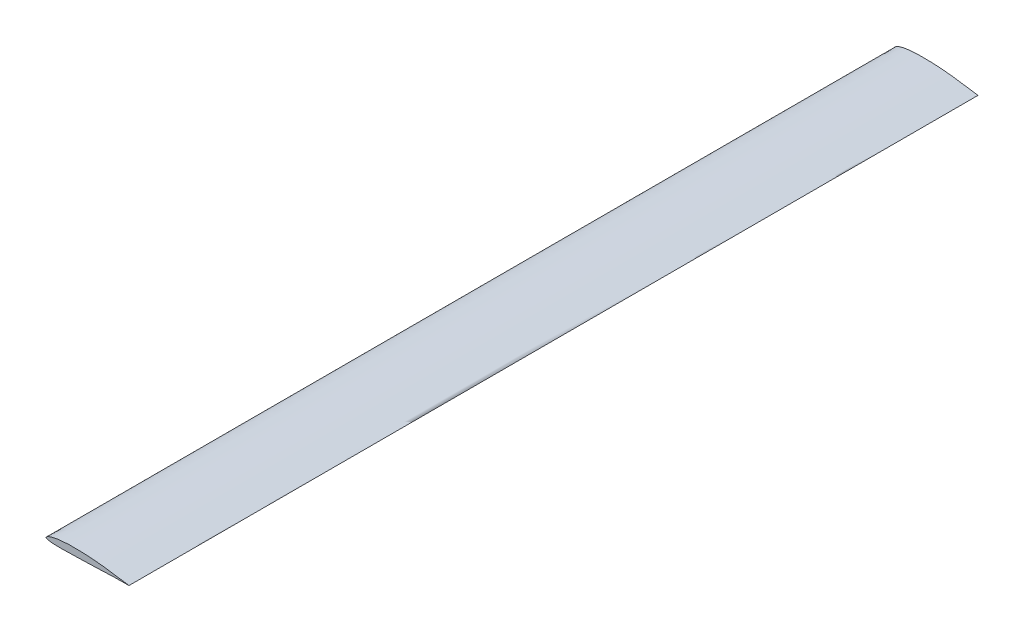
from build123d import *

# Parameters (mm, degrees)
BOSS_EXTRUDE1_DEPTH = 1800
SKETCH2_W           = 90
SKETCH2_H           = 10
BOSS_EXTRUDE2_DEPTH = 5


with BuildPart() as part:
    # Sketch1 → Boss-Extrude1 (new body)
    with BuildSketch(Plane.XY):
        with BuildLine():
            add(Edge.make_bspline(
                [(176, 0), (176.000448168, 0.008528228), (174.775687711, 0.116014347), (173.539862172, 0.292823553), (170.576644495, 0.68447631), (166.994008352, 1.231561447), (162.390893659, 1.953121821), (157.046507363, 2.81357381), (150.980940891, 3.784301173), (144.305054601, 4.825851118), (137.095965705, 5.894836578), (129.431536803, 6.938326969), (121.383114145, 7.919159936), (113.023648272, 8.817037249), (104.433502202, 9.617484246), (95.705002498, 10.319873845), (86.933937997, 10.910672491), (78.210236331, 11.352546191), (69.620135682, 11.632898447), (61.246487312, 11.752460911), (53.167199991, 11.68978229), (45.456481335, 11.437289203), (38.183363377, 11.016259402), (31.414274166, 10.41771219), (25.207733209, 9.646309609), (19.611741621, 8.718035158), (14.668117481, 7.652130641), (10.41084687, 6.468442078), (6.865637299, 5.199967353), (4.043833985, 3.882721172), (1.966727298, 2.57339806), (0.802827382, 1.536843817), (0.316772441, 0.842811405), (0.143667303, 0.535793127), (0.036783447, 0.259871381), (-0.005432106, 0.042345271), (0.003068779, -0.129064014), (0.087014725, -0.282932468), (0.24435104, -0.45921503), (0.496497658, -0.663687133), (1.106753569, -1.042725168), (2.465799929, -1.596705872), (4.850890225, -2.211164221), (8.227849509, -2.772826342), (12.457165416, -3.232096929), (17.509071166, -3.574246073), (23.341856395, -3.79928919), (29.904548764, -3.909503713), (37.134834963, -3.914209135), (44.960125584, -3.825485128), (53.297870775, -3.657038535), (62.05706854, -3.422344085), (71.140389764, -3.134787777), (80.445446567, -2.807726471), (89.866615493, -2.453169736), (99.295895108, -2.085526265), (108.623824195, -1.716511267), (117.740479476, -1.360901457), (126.536403649, -1.029166105), (134.904058565, -0.73233168), (142.739535017, -0.47819149), (149.939311258, -0.276242626), (156.414914239, -0.128343779), (162.052888361, -0.032203005), (166.844415568, 0.015172189), (170.523071372, 0.033657502), (173.526311225, 0.014823685), (174.773283831, 0.031617), (175.999551427, -0.008535929), (176, 0)],
                knots=[0, 0, 0, 0, 0.00163101, 0.006435235, 0.014220669, 0.024765625, 0.037826727, 0.053149348, 0.070473504, 0.089535694, 0.110075428, 0.131859875, 0.154692567, 0.178371256, 0.202679512, 0.227363961, 0.252132687, 0.276728351, 0.300939435, 0.324527111, 0.347267377, 0.368991726, 0.389507471, 0.40862838, 0.426224009, 0.442178728, 0.456395551, 0.468805124, 0.479372318, 0.488085518, 0.494967924, 0.50003381, 0.501035663, 0.50209449, 0.502996978, 0.50351288, 0.503955826, 0.504408894, 0.504955423, 0.505942626, 0.507129614, 0.510997735, 0.518231919, 0.527845532, 0.539808758, 0.554055915, 0.570489592, 0.588973674, 0.609342058, 0.631392897, 0.654894034, 0.679589725, 0.705203145, 0.731446604, 0.758020282, 0.784619628, 0.810935624, 0.836656653, 0.861473352, 0.885081475, 0.907187944, 0.927507338, 0.945765257, 0.961711874, 0.975121793, 0.985796266, 0.993581185, 0.998367518, 1, 1, 1, 1], degree=3))
        make_face()
    extrude(amount=BOSS_EXTRUDE1_DEPTH)

    # Sketch2 → Boss-Extrude2 (add)
    with BuildSketch(Plane(origin=(0, 0, 0), x_dir=(1, 0, 0), z_dir=(0, 1, 0))):
        with Locations((87.999831648, -900)):
            Rectangle(SKETCH2_W, SKETCH2_H)
    extrude(amount=-BOSS_EXTRUDE2_DEPTH)


solid = part.part
